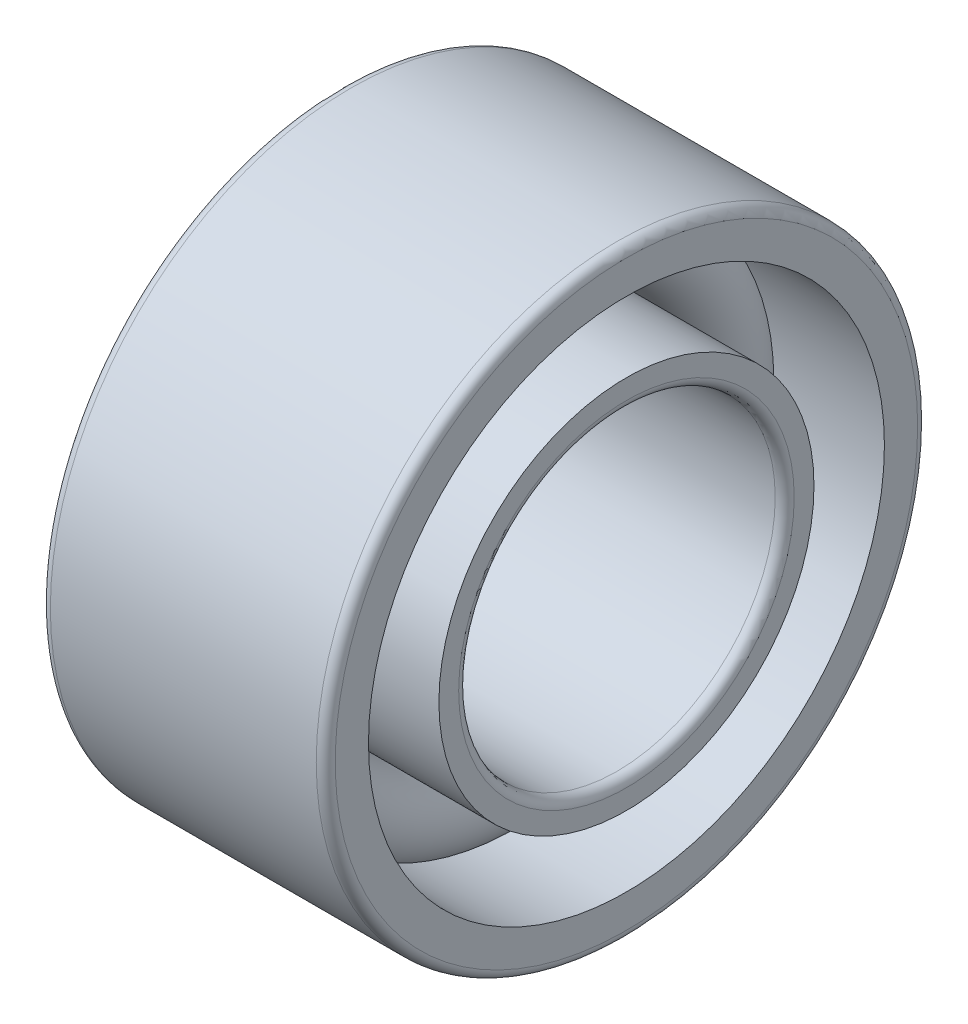
from build123d import *

# Parameters (mm, degrees)
CAGSPISKE_W     = 0.675
CAGSPISKE_H     = 0.45
CAGESPINE_ANGLE = 0.001
BALSIMSKE_R     = 1.35


with BuildPart() as part:
    # CagSpiSke → CageSpine (revolve)
    with BuildSketch(Plane.XY):
        with Locations((0, 7.25)):
            Rectangle(CAGSPISKE_W, CAGSPISKE_H)
    revolve(axis=Axis((-20.6375, 0, 0), (1, 0, 0)), revolution_arc=CAGESPINE_ANGLE)

    # BalSimSke → BallsSimplified (revolve)
    with BuildSketch(Plane.XY):
        with Locations((0, 7.25)):
            Circle(BALSIMSKE_R)
    revolve(axis=Axis((-10, 0, 0), (1, 0, 0)))

    # InnRacSke → InnerRace (revolve)
    with BuildSketch(Plane.XY):
        with BuildLine():
            Line((-0.972432517, 6.35), (-4.5, 6.35))
            Line((-4.5, 6.35), (-4.5, 5.3))
            ThreePointArc((-4.5, 5.3), (-4.412132034, 5.087867966), (-4.2, 5))
            Line((-4.2, 5), (4.2, 5))
            ThreePointArc((4.2, 5), (4.412132034, 5.087867966), (4.5, 5.3))
            Line((4.5, 5.3), (4.5, 5.925))
            Line((4.5, 5.925), (0, 5.925))
            ThreePointArc((0, 5.925), (-0.530624632, 6.035890244), (-0.972432517, 6.35))
        make_face()
    revolve(axis=Axis((-20.6375, 0, 0), (1, 0, 0)))

    # OutRacSke → OuterRace (revolve)
    with BuildSketch(Plane.XY):
        with BuildLine():
            Line((0, 8.575), (-4.5, 8.575))
            Line((-4.5, 8.575), (-4.5, 9.2))
            ThreePointArc((-4.5, 9.2), (-4.412132034, 9.412132034), (-4.2, 9.5))
            Line((-4.2, 9.5), (4.2, 9.5))
            ThreePointArc((4.2, 9.5), (4.412132034, 9.412132034), (4.5, 9.2))
            Line((4.5, 9.2), (4.5, 8.15))
            Line((4.5, 8.15), (0.972432517, 8.15))
            ThreePointArc((0.972432517, 8.15), (0.530624632, 8.464109756), (0, 8.575))
        make_face()
    revolve(axis=Axis((-20.6375, 0, 0), (1, 0, 0)))


solid = part.part
